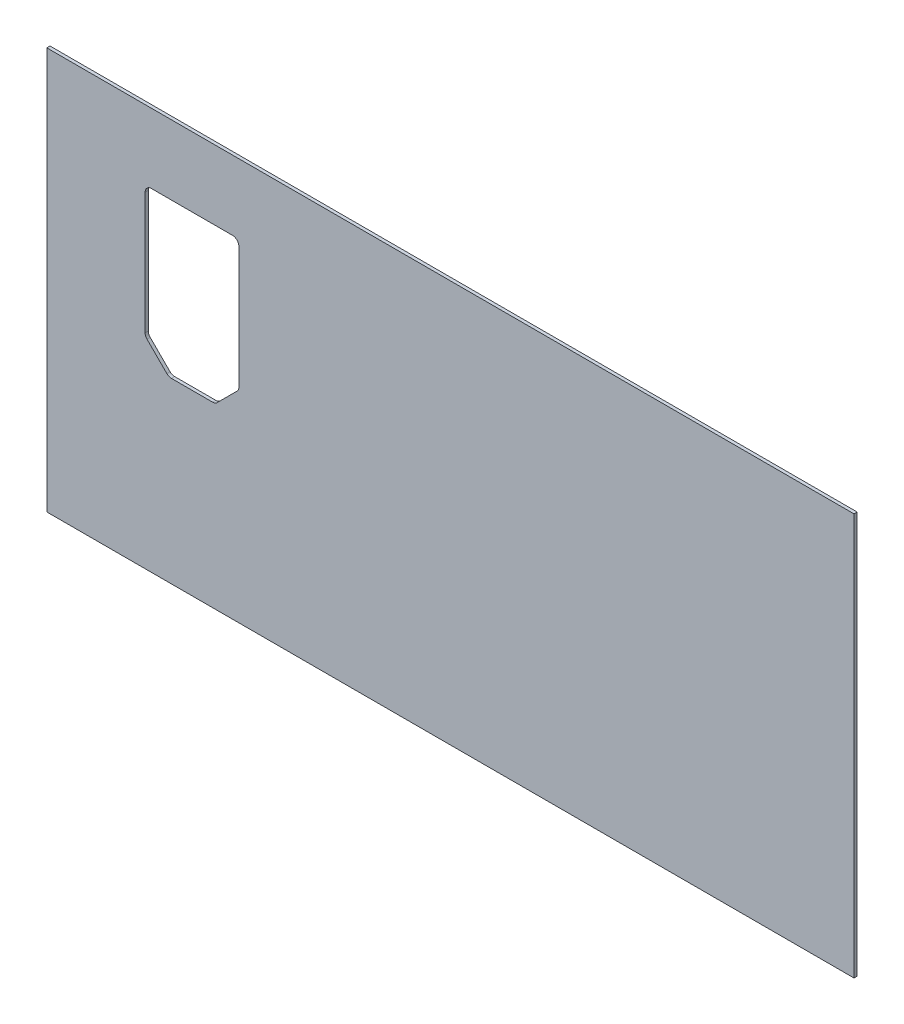
from build123d import *

# Parameters (mm, degrees)
SKETCH1_W          = 253
SKETCH1_H          = 126
BASE_FLANGE1_DEPTH = 1


# Sheet-metal steps are written as plain solids
with BuildPart() as part:
    # Sketch1 → Base-Flange1 (new body)
    with BuildSketch(Plane.XY):
        Rectangle(SKETCH1_W, SKETCH1_H)
        with BuildLine():
            Line((-81, -7.2), (-74.538477631, -7.2))
            ThreePointArc((-74.538477631, -7.2), (-73.773110766, -7.047759065), (-73.124264069, -6.614213562))
            Line((-73.124264069, -6.614213562), (-70.005025253, -3.494974747))
            Line((-70.005025253, -3.494974747), (-66.885786438, -0.375735931))
            ThreePointArc((-66.885786438, -0.375735931), (-66.452240935, 0.273110766), (-66.3, 1.038477631))
            Line((-66.3, 1.038477631), (-66.3, 39.2))
            ThreePointArc((-66.3, 39.2), (-66.885786438, 40.614213562), (-68.3, 41.2))
            Line((-68.3, 41.2), (-93.7, 41.2))
            ThreePointArc((-93.7, 41.2), (-95.114213562, 40.614213562), (-95.7, 39.2))
            Line((-95.7, 39.2), (-95.7, 19.75))
            Line((-95.7, 19.75), (-95.7, 1.038477631))
            ThreePointArc((-95.7, 1.038477631), (-95.547759065, 0.273110766), (-95.114213562, -0.375735931))
            Line((-95.114213562, -0.375735931), (-94.064941978, -1.425007515))
            Line((-94.064941978, -1.425007515), (-91.994974747, -3.494974747))
            Line((-91.994974747, -3.494974747), (-88.875735931, -6.614213562))
            ThreePointArc((-88.875735931, -6.614213562), (-88.226889234, -7.047759065), (-87.461522369, -7.2))
            Line((-87.461522369, -7.2), (-81, -7.2))
        make_face(mode=Mode.SUBTRACT)
    extrude(amount=-BASE_FLANGE1_DEPTH)


solid = part.part
